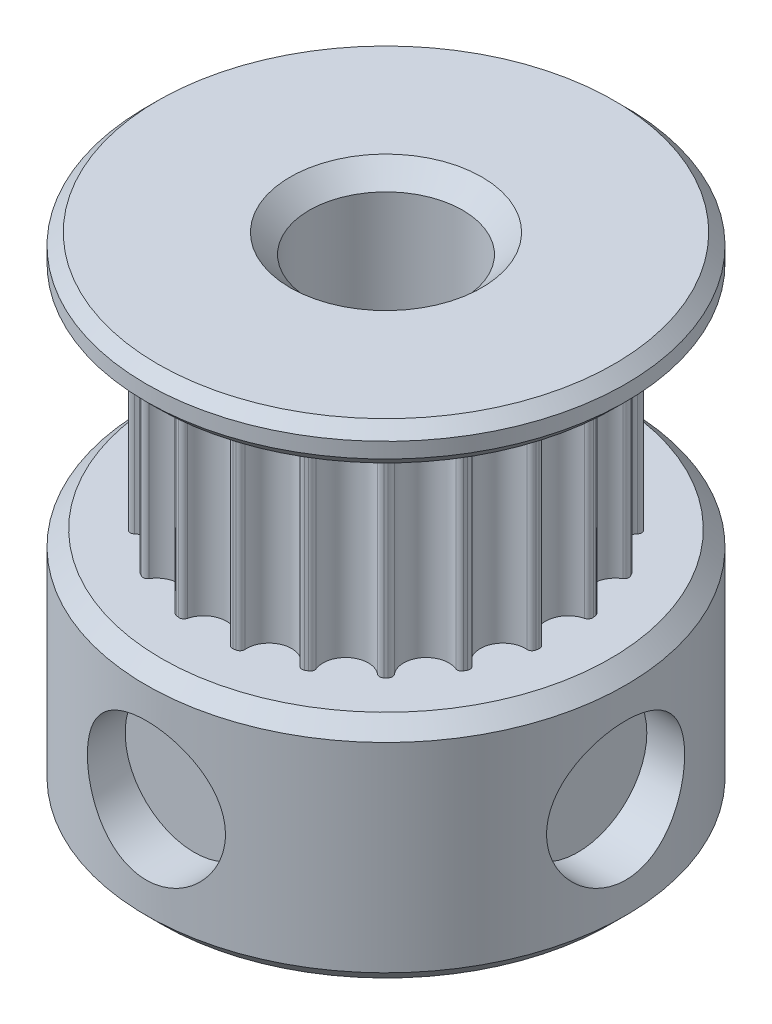
from build123d import *

# Parameters (mm, degrees)
BOSS_EXTRUDE1_DEPTH      = 7.239
BOSS_EXTRUDE2_START      = -7.62
SKETCH3_R                = 7.9375
BOSS_EXTRUDE2_DEPTH      = 7.62
M4_CLEARANCE_HOLE1_D     = 4.572
M4_CLEARANCE_HOLE1_DEPTH = 1.5875
M4_CLEARANCE_HOLE2_D     = 4.572
M4_CLEARANCE_HOLE2_DEPTH = 1.587491646
HOLE1_D                  = 5.08
CHAMFER1_SIZE            = 0.635
CHAMFER2_SIZE            = 0.508
FILLET1_R                = 0.152041167


with BuildPart() as part:
    # Sketch1 → Revolve1 (revolve)
    with BuildSketch(Plane(origin=(0, 0, 0), x_dir=(-1, 0, 0), z_dir=(0, 0, -1))):
        Polygon((-7.5565, 14.859), (0, 14.859), (0, 16.129), (-7.5565, 16.129), (-7.9375, 15.748), (-7.9375, 15.24), align=None)
    revolve(axis=Axis((0, 14.859, 0), (0, 1, 0)))

    # Sketch2 → Boss-Extrude1 (add)
    with BuildSketch(Plane.XZ.offset(-14.859)):
        with BuildLine():
            ThreePointArc((4.301108464, 4.22983714), (4.352221113, 4.177227266), (4.402690301, 4.123999801))
            ThreePointArc((4.402690301, 4.123999801), (4.273632273, 3.104975595), (5.282663008, 2.912821277))
            ThreePointArc((5.282663008, 2.912821277), (5.317689498, 2.848374036), (5.351929785, 2.783505672))
            add(Edge.make_bspline(
                [(5.397688791, 2.693698565), (5.382685881, 2.723761695), (5.367432879, 2.753697397), (5.351929785, 2.783505672)],
                knots=[0, 0, 0, 0, 1, 1, 1, 1], degree=3))
            ThreePointArc((5.397688791, 2.693698565), (5.430042465, 2.627868924), (5.461593324, 2.56165076))
            ThreePointArc((5.461593324, 2.56165076), (5.023956047, 1.632382273), (5.924222354, 1.137825011))
            ThreePointArc((5.924222354, 1.137825011), (5.937619233, 1.065708262), (5.950138253, 0.993433951))
            add(Edge.make_bspline(
                [(5.965905732, 0.893882007), (5.960927135, 0.927109897), (5.955671309, 0.960293879), (5.950138253, 0.993433951)],
                knots=[0, 0, 0, 0, 1, 1, 1, 1], degree=3))
            ThreePointArc((5.965905732, 0.893882007), (5.976333426, 0.821276462), (5.985877538, 0.748549495))
            ThreePointArc((5.985877538, 0.748549495), (5.2825, 0), (5.985877538, -0.748549495))
            ThreePointArc((5.985877538, -0.748549495), (5.976333426, -0.821276462), (5.965905732, -0.893882007))
            add(Edge.make_bspline(
                [(5.950138253, -0.993433951), (5.955671309, -0.960293879), (5.960927135, -0.927109897), (5.965905732, -0.893882007)],
                knots=[0, 0, 0, 0, 1, 1, 1, 1], degree=3))
            ThreePointArc((5.950138253, -0.993433951), (5.937619233, -1.065708262), (5.924222354, -1.137825011))
            ThreePointArc((5.924222354, -1.137825011), (5.023956047, -1.632382273), (5.461593324, -2.56165076))
            ThreePointArc((5.461593324, -2.56165076), (5.430042465, -2.627868924), (5.397688791, -2.693698565))
            add(Edge.make_bspline(
                [(5.351929785, -2.783505672), (5.367432879, -2.753697398), (5.382685881, -2.723761696), (5.397688791, -2.693698565)],
                knots=[0, 0, 0, 0, 1, 1, 1, 1], degree=3))
            ThreePointArc((5.351929785, -2.783505672), (5.317689498, -2.848374036), (5.282663008, -2.912821277))
            ThreePointArc((5.282663008, -2.912821277), (4.273632273, -3.104975595), (4.402690301, -4.123999801))
            ThreePointArc((4.402690301, -4.123999801), (4.352221113, -4.177227266), (4.301108464, -4.22983714))
            add(Edge.make_bspline(
                [(4.22983714, -4.301108464), (4.253792722, -4.27754983), (4.277549829, -4.253792723), (4.301108464, -4.22983714)],
                knots=[0, 0, 0, 0, 1, 1, 1, 1], degree=3))
            ThreePointArc((4.22983714, -4.301108464), (4.177227266, -4.352221113), (4.123999801, -4.402690301))
            ThreePointArc((4.123999801, -4.402690301), (3.104975595, -4.273632273), (2.912821277, -5.282663008))
            ThreePointArc((2.912821277, -5.282663008), (2.848374036, -5.317689498), (2.783505672, -5.351929785))
            add(Edge.make_bspline(
                [(2.693698565, -5.397688791), (2.723761695, -5.382685881), (2.753697397, -5.367432879), (2.783505672, -5.351929785)],
                knots=[0, 0, 0, 0, 1, 1, 1, 1], degree=3))
            ThreePointArc((2.693698565, -5.397688791), (2.627868924, -5.430042465), (2.56165076, -5.461593324))
            ThreePointArc((2.56165076, -5.461593324), (1.632382273, -5.023956047), (1.137825011, -5.924222354))
            ThreePointArc((1.137825011, -5.924222354), (1.065708262, -5.937619233), (0.993433951, -5.950138253))
            add(Edge.make_bspline(
                [(0.893882007, -5.965905732), (0.927109896, -5.960927135), (0.960293878, -5.955671309), (0.993433951, -5.950138253)],
                knots=[0, 0, 0, 0, 1, 1, 1, 1], degree=3))
            ThreePointArc((0.893882007, -5.965905732), (0.821276462, -5.976333426), (0.748549495, -5.985877538))
            ThreePointArc((0.748549495, -5.985877538), (0, -5.2825), (-0.748549495, -5.985877538))
            ThreePointArc((-0.748549495, -5.985877538), (-0.821276462, -5.976333426), (-0.893882007, -5.965905732))
            add(Edge.make_bspline(
                [(-0.993433951, -5.950138253), (-0.960293879, -5.955671309), (-0.927109897, -5.960927135), (-0.893882007, -5.965905732)],
                knots=[0, 0, 0, 0, 1, 1, 1, 1], degree=3))
            ThreePointArc((-0.993433951, -5.950138253), (-1.065708262, -5.937619233), (-1.137825011, -5.924222354))
            ThreePointArc((-1.137825011, -5.924222354), (-1.632382273, -5.023956047), (-2.56165076, -5.461593324))
            ThreePointArc((-2.56165076, -5.461593324), (-2.627868924, -5.430042465), (-2.693698565, -5.397688791))
            add(Edge.make_bspline(
                [(-2.783505672, -5.351929785), (-2.753697398, -5.367432879), (-2.723761696, -5.382685881), (-2.693698565, -5.397688791)],
                knots=[0, 0, 0, 0, 1, 1, 1, 1], degree=3))
            ThreePointArc((-2.783505672, -5.351929785), (-2.848374036, -5.317689498), (-2.912821277, -5.282663008))
            ThreePointArc((-2.912821277, -5.282663008), (-3.104975595, -4.273632273), (-4.123999801, -4.402690301))
            ThreePointArc((-4.123999801, -4.402690301), (-4.177227266, -4.352221113), (-4.22983714, -4.301108464))
            add(Edge.make_bspline(
                [(-4.301108464, -4.22983714), (-4.27754983, -4.253792722), (-4.253792723, -4.277549829), (-4.22983714, -4.301108464)],
                knots=[0, 0, 0, 0, 1, 1, 1, 1], degree=3))
            ThreePointArc((-4.301108464, -4.22983714), (-4.352221113, -4.177227266), (-4.402690301, -4.123999801))
            ThreePointArc((-4.402690301, -4.123999801), (-4.273632273, -3.104975595), (-5.282663008, -2.912821277))
            ThreePointArc((-5.282663008, -2.912821277), (-5.317689498, -2.848374036), (-5.351929785, -2.783505672))
            add(Edge.make_bspline(
                [(-5.397688791, -2.693698565), (-5.382685881, -2.723761695), (-5.367432879, -2.753697397), (-5.351929785, -2.783505672)],
                knots=[0, 0, 0, 0, 1, 1, 1, 1], degree=3))
            ThreePointArc((-5.397688791, -2.693698565), (-5.430042465, -2.627868924), (-5.461593324, -2.56165076))
            ThreePointArc((-5.461593324, -2.56165076), (-5.023956047, -1.632382273), (-5.924222354, -1.137825011))
            ThreePointArc((-5.924222354, -1.137825011), (-5.937619233, -1.065708262), (-5.950138253, -0.993433951))
            add(Edge.make_bspline(
                [(-5.965905732, -0.893882007), (-5.960927135, -0.927109896), (-5.955671309, -0.960293878), (-5.950138253, -0.993433951)],
                knots=[0, 0, 0, 0, 1, 1, 1, 1], degree=3))
            ThreePointArc((-5.965905732, -0.893882007), (-5.976333426, -0.821276462), (-5.985877538, -0.748549495))
            ThreePointArc((-5.985877538, -0.748549495), (-5.2825, 0), (-5.985877538, 0.748549495))
            ThreePointArc((-5.985877538, 0.748549495), (-5.976333426, 0.821276462), (-5.965905732, 0.893882007))
            add(Edge.make_bspline(
                [(-5.950138253, 0.993433951), (-5.955671309, 0.960293879), (-5.960927135, 0.927109897), (-5.965905732, 0.893882007)],
                knots=[0, 0, 0, 0, 1, 1, 1, 1], degree=3))
            ThreePointArc((-5.950138253, 0.993433951), (-5.937619233, 1.065708262), (-5.924222354, 1.137825011))
            ThreePointArc((-5.924222354, 1.137825011), (-5.023956047, 1.632382273), (-5.461593324, 2.56165076))
            ThreePointArc((-5.461593324, 2.56165076), (-5.430042465, 2.627868924), (-5.397688791, 2.693698565))
            add(Edge.make_bspline(
                [(-5.351929785, 2.783505672), (-5.367432879, 2.753697398), (-5.382685881, 2.723761696), (-5.397688791, 2.693698565)],
                knots=[0, 0, 0, 0, 1, 1, 1, 1], degree=3))
            ThreePointArc((-5.351929785, 2.783505672), (-5.317689498, 2.848374036), (-5.282663008, 2.912821277))
            ThreePointArc((-5.282663008, 2.912821277), (-4.273632273, 3.104975595), (-4.402690301, 4.123999801))
            ThreePointArc((-4.402690301, 4.123999801), (-4.352221113, 4.177227266), (-4.301108464, 4.22983714))
            add(Edge.make_bspline(
                [(-4.22983714, 4.301108464), (-4.253792722, 4.27754983), (-4.277549829, 4.253792723), (-4.301108464, 4.22983714)],
                knots=[0, 0, 0, 0, 1, 1, 1, 1], degree=3))
            ThreePointArc((-4.22983714, 4.301108464), (-4.177227266, 4.352221113), (-4.123999801, 4.402690301))
            ThreePointArc((-4.123999801, 4.402690301), (-3.104975595, 4.273632273), (-2.912821277, 5.282663008))
            ThreePointArc((-2.912821277, 5.282663008), (-2.848374036, 5.317689498), (-2.783505672, 5.351929785))
            add(Edge.make_bspline(
                [(-2.693698565, 5.397688791), (-2.723761695, 5.382685881), (-2.753697397, 5.367432879), (-2.783505672, 5.351929785)],
                knots=[0, 0, 0, 0, 1, 1, 1, 1], degree=3))
            ThreePointArc((-2.693698565, 5.397688791), (-2.627868924, 5.430042465), (-2.56165076, 5.461593324))
            ThreePointArc((-2.56165076, 5.461593324), (-1.632382273, 5.023956047), (-1.137825011, 5.924222354))
            ThreePointArc((-1.137825011, 5.924222354), (-1.065708262, 5.937619233), (-0.993433951, 5.950138253))
            add(Edge.make_bspline(
                [(-0.893882007, 5.965905732), (-0.927109896, 5.960927135), (-0.960293878, 5.955671309), (-0.993433951, 5.950138253)],
                knots=[0, 0, 0, 0, 1, 1, 1, 1], degree=3))
            ThreePointArc((-0.893882007, 5.965905732), (-0.821276462, 5.976333426), (-0.748549495, 5.985877538))
            ThreePointArc((-0.748549495, 5.985877538), (0, 5.2825), (0.748549495, 5.985877538))
            ThreePointArc((0.748549495, 5.985877538), (0.821276462, 5.976333426), (0.893882007, 5.965905732))
            add(Edge.make_bspline(
                [(0.993433951, 5.950138253), (0.960293879, 5.955671309), (0.927109897, 5.960927135), (0.893882007, 5.965905732)],
                knots=[0, 0, 0, 0, 1, 1, 1, 1], degree=3))
            ThreePointArc((0.993433951, 5.950138253), (1.065708262, 5.937619233), (1.137825011, 5.924222354))
            ThreePointArc((1.137825011, 5.924222354), (1.632382273, 5.023956047), (2.56165076, 5.461593324))
            ThreePointArc((2.56165076, 5.461593324), (2.627868924, 5.430042465), (2.693698565, 5.397688791))
            add(Edge.make_bspline(
                [(2.783505672, 5.351929785), (2.753697398, 5.367432879), (2.723761696, 5.382685881), (2.693698565, 5.397688791)],
                knots=[0, 0, 0, 0, 1, 1, 1, 1], degree=3))
            ThreePointArc((2.783505672, 5.351929785), (2.848374036, 5.317689498), (2.912821277, 5.282663008))
            ThreePointArc((2.912821277, 5.282663008), (3.104975595, 4.273632273), (4.123999801, 4.402690301))
            ThreePointArc((4.123999801, 4.402690301), (4.177227266, 4.352221113), (4.22983714, 4.301108464))
            add(Edge.make_bspline(
                [(4.301108464, 4.22983714), (4.27754983, 4.253792722), (4.253792723, 4.277549829), (4.22983714, 4.301108464)],
                knots=[0, 0, 0, 0, 1, 1, 1, 1], degree=3))
        make_face()
    extrude(amount=BOSS_EXTRUDE1_DEPTH)

    # Sketch3 → Boss-Extrude2 (add)
    with BuildSketch(Plane(origin=(0, 7.62, 0), x_dir=(1, 0, 0), z_dir=(0, 1, 0)).offset(BOSS_EXTRUDE2_START)):
        Circle(SKETCH3_R)
    extrude(amount=BOSS_EXTRUDE2_DEPTH)

    # M4 Clearance Hole1
    with Locations(Plane(origin=(7.9375, 3.81, 0), x_dir=(0, 0, 1), z_dir=(1, 0, 0))):
        with Locations((0, 0)):
            Hole(M4_CLEARANCE_HOLE1_D / 2, depth=M4_CLEARANCE_HOLE1_DEPTH)

    # M4 Clearance Hole2
    with Locations(Plane(origin=(0, 3.81, 7.9375), x_dir=(1, 0, 0), z_dir=(0, 0, 1))):
        with Locations((0, 0)):
            Hole(M4_CLEARANCE_HOLE2_D / 2, depth=M4_CLEARANCE_HOLE2_DEPTH)

    # Hole1 (through all)
    with Locations(Plane(origin=(0, 0, 0), x_dir=(-1, 0, 0), z_dir=(0, -1, 0))):
        with Locations((0, 0)):
            Hole(HOLE1_D / 2)

    # Chamfer1
    chamfer1_edges = [part.edges().sort_by_distance(p)[0] for p in [
        (-2.54, 16.129, 0),
        (-2.54, 0, 0),
    ]]
    chamfer(chamfer1_edges, length=CHAMFER1_SIZE)

    # Chamfer2
    chamfer2_edges = [part.edges().sort_by_distance(p)[0] for p in [
        (-7.9375, 0, 0),
        (-7.9375, 7.62, 0),
    ]]
    chamfer(chamfer2_edges, length=CHAMFER2_SIZE)

    # Fillet1
    fillet1_edges = [part.edges().sort_by_distance(p)[0] for p in [
        (4.123999801, 11.2395, -4.402690301),
        (-2.912821277, 11.2395, -5.282663008),
        (5.461593324, 11.2395, 2.56165076),
        (5.282663008, 11.2395, 2.912821277),
        (0.748549495, 11.2395, -5.985877538),
        (4.402690301, 11.2395, 4.123999801),
        (5.924222354, 11.2395, -1.137825011),
        (4.123999801, 11.2395, 4.402690301),
        (-4.402690301, 11.2395, -4.123999801),
        (2.912821277, 11.2395, 5.282663008),
        (-1.137825011, 11.2395, -5.924222354),
        (2.56165076, 11.2395, 5.461593324),
        (2.56165076, 11.2395, -5.461593324),
        (1.137825011, 11.2395, 5.924222354),
        (5.282663008, 11.2395, -2.912821277),
        (0.748549495, 11.2395, 5.985877538),
        (5.985877538, 11.2395, 0.748549495),
        (-0.748549495, 11.2395, 5.985877538),
        (-5.282663008, 11.2395, -2.912821277),
        (-1.137825011, 11.2395, 5.924222354),
        (-4.123999801, 11.2395, -4.402690301),
        (-2.56165076, 11.2395, 5.461593324),
        (-2.56165076, 11.2395, -5.461593324),
        (-2.912821277, 11.2395, 5.282663008),
        (-0.748549495, 11.2395, -5.985877538),
        (-4.123999801, 11.2395, 4.402690301),
        (1.137825011, 11.2395, -5.924222354),
        (-4.402690301, 11.2395, 4.123999801),
        (2.912821277, 11.2395, -5.282663008),
        (-5.282663008, 11.2395, 2.912821277),
        (4.402690301, 11.2395, -4.123999801),
        (-5.461593324, 11.2395, 2.56165076),
        (5.461593324, 11.2395, -2.56165076),
        (-5.924222354, 11.2395, 1.137825011),
        (5.985877538, 11.2395, -0.748549495),
        (-5.985877538, 11.2395, 0.748549495),
        (5.924222354, 11.2395, 1.137825011),
        (-5.924222354, 11.2395, -1.137825011),
        (-5.461593324, 11.2395, -2.56165076),
        (-5.985877538, 11.2395, -0.748549495),
    ]]
    fillet(fillet1_edges, radius=FILLET1_R)


solid = part.part
